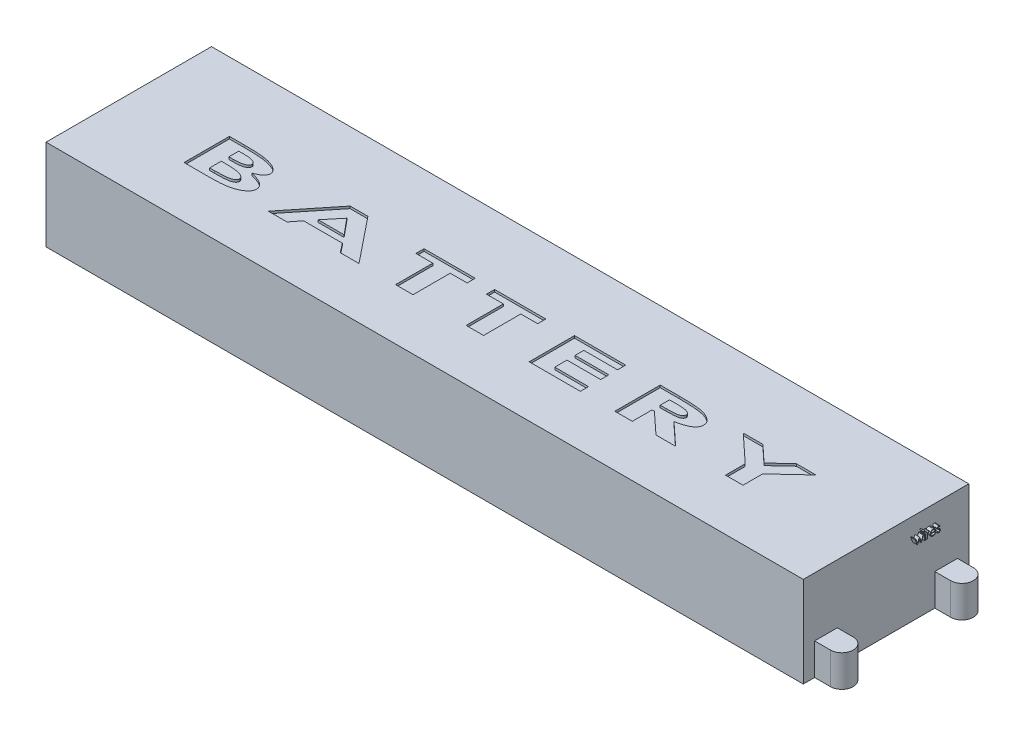
from build123d import *

# Parameters (mm, degrees)
SKETCH1_W           = 334
SKETCH1_H           = 73
BOSS_EXTRUDE1_DEPTH = 40
BOSS_EXTRUDE3_DEPTH = 14
SKETCH2_W           = 0.314102564
SKETCH2_H           = 2.557692308
BOSS_EXTRUDE2_DEPTH = 2
CUT_EXTRUDE1_DEPTH  = 1


with BuildPart() as part:
    # Sketch1 → Boss-Extrude1 (new body)
    with BuildSketch(Plane(origin=(0, 0, 0), x_dir=(1, 0, 0), z_dir=(0, 1, 0))):
        Rectangle(SKETCH1_W, SKETCH1_H)
    extrude(amount=BOSS_EXTRUDE1_DEPTH)

    # Sketch4 → Boss-Extrude3 (add)
    with BuildSketch(Plane(origin=(0, 0, 0), x_dir=(1, 0, 0), z_dir=(0, 1, 0))):
        with BuildLine():
            Line((167, -21.5), (174, -21.5))
            ThreePointArc((174, -21.5), (179, -26.5), (174, -31.5))
            Line((174, -31.5), (167, -31.5))
            Line((167, -31.5), (167, -21.5))
        make_face()
    boss_extrude3 = extrude(amount=BOSS_EXTRUDE3_DEPTH)

    # Mirror1: Boss-Extrude3 across plane
    add(boss_extrude3.mirror(Plane.XY))

    # Sketch2 → Boss-Extrude2 (add)
    # profile 1 of 6: a face of its own
    with BuildSketch(Plane(origin=(167, 0, 0), x_dir=(0, 0, -1), z_dir=(1, 0, 0))):
        Polygon((10.778846154, 32.557692308), (11.116085737, 32.557692308), (11.878205128, 30.717948718), (12.713241186, 32.557692308), (12.766526442, 32.557692308), (13.583333333, 30.717948718), (14.352463942, 32.557692308), (14.682692308, 32.557692308), (13.613481571, 30), (13.548277244, 30), (12.730769231, 31.83974359), (11.896434295, 30), (11.838241186, 30), align=None)
    # profile 2 of 6: a face of its own
    with BuildSketch(Plane(origin=(167, 0, 0), x_dir=(0, 0, -1), z_dir=(1, 0, 0))):
        with BuildLine():
            add(Edge.make_bspline(
                [(15.197315705, 33.634615385), (15.216807021, 33.633711232), (15.254974761, 33.631940728), (15.310168028, 33.616779251), (15.360425041, 33.591079566), (15.405002773, 33.556599885), (15.44325466, 33.516050441), (15.47003537, 33.468789473), (15.487247767, 33.417730834), (15.489326322, 33.382115745), (15.490384615, 33.363982372)],
                knots=[0, 0, 0, 0, 1.055194115, 2.066272739, 3.074728998, 4.095836921, 5.109056067, 6.073838105, 7.019297344, 8, 8, 8, 8], degree=3))
            add(Edge.make_bspline(
                [(15.490384615, 33.363982372), (15.489302456, 33.346319719), (15.487163154, 33.311402744), (15.470048665, 33.261229272), (15.443026428, 33.214624988), (15.405027302, 33.174154278), (15.360418541, 33.139693658), (15.310169755, 33.113988919), (15.254974307, 33.098828782), (15.216806867, 33.097058093), (15.197315705, 33.096153846)],
                knots=[0, 0, 0, 0, 0.96129708, 1.900370562, 2.859976407, 3.87933698, 4.906634145, 5.921202961, 6.938410037, 8, 8, 8, 8], degree=3))
            add(Edge.make_bspline(
                [(15.197315705, 33.096153846), (15.17804743, 33.097023566), (15.14054425, 33.098716363), (15.086177407, 33.114286381), (15.036348918, 33.139702454), (14.991684245, 33.173928639), (14.954454052, 33.214873536), (14.927355727, 33.26120083), (14.910280765, 33.311409985), (14.908136136, 33.346322151), (14.907051282, 33.363982372)],
                knots=[0, 0, 0, 0, 1.054934014, 2.053291228, 3.073705704, 4.106921865, 5.123545215, 6.088680038, 7.033164197, 8, 8, 8, 8], degree=3))
            add(Edge.make_bspline(
                [(14.907051282, 33.363982372), (14.908112369, 33.382113221), (14.91019641, 33.417723354), (14.927368526, 33.468818387), (14.954228334, 33.515799889), (14.991708897, 33.556825388), (15.036342357, 33.591070823), (15.086179103, 33.616481804), (15.140543802, 33.632053144), (15.178047278, 33.633745758), (15.197315705, 33.634615385)],
                knots=[0, 0, 0, 0, 0.98631895, 1.937192651, 2.907499808, 3.917963147, 4.944918757, 5.95915025, 6.951458133, 8, 8, 8, 8], degree=3))
        make_face()
    # profile 3 of 6: a face of its own
    with BuildSketch(Plane(origin=(167, 0, 0), x_dir=(0, 0, -1), z_dir=(1, 0, 0))):
        with Locations((15.198717949, 31.278846154)):
            Rectangle(SKETCH2_W, SKETCH2_H)
    # profile 4 of 6: a face of its own
    with BuildSketch(Plane(origin=(167, 0, 0), x_dir=(0, 0, -1), z_dir=(1, 0, 0))):
        with BuildLine():
            Line((16.028846154, 32.557692308), (16.342948718, 32.557692308))
            Line((16.342948718, 32.557692308), (16.342948718, 32.181189904))
            add(Edge.make_bspline(
                [(16.342948718, 32.181189904), (16.366137477, 32.216245732), (16.410485798, 32.283289731), (16.484198727, 32.371959032), (16.559702058, 32.445374079), (16.637357246, 32.503877598), (16.717735345, 32.547690717), (16.799072297, 32.579783752), (16.882647767, 32.598761067), (16.938809691, 32.601294726), (16.966947115, 32.602564103)],
                knots=[0, 0, 0, 0, 1.2804753, 2.448899062, 3.506932113, 4.484331642, 5.4025378, 6.288909075, 7.142734305, 8, 8, 8, 8], degree=3))
            add(Edge.make_bspline(
                [(16.966947115, 32.602564103), (16.988773442, 32.601373576), (17.033682527, 32.59892399), (17.101665117, 32.581713165), (17.171708569, 32.554235143), (17.216850956, 32.52839492), (17.240384615, 32.514923878)],
                knots=[0, 0, 0, 0, 0.901110191, 1.854092781, 2.881294221, 4, 4, 4, 4], degree=3))
            Line((17.240384615, 32.514923878), (17.067908654, 32.242888622))
            add(Edge.make_bspline(
                [(17.067908654, 32.242888622), (17.052799633, 32.249628888), (17.024119818, 32.262423203), (16.982165252, 32.277565213), (16.943483915, 32.286481129), (16.918840357, 32.287831847), (16.907351763, 32.288461538)],
                knots=[0, 0, 0, 0, 1.180555205, 2.24091978, 3.179933427, 4, 4, 4, 4], degree=3))
            add(Edge.make_bspline(
                [(16.907351763, 32.288461538), (16.882146029, 32.286781501), (16.830733639, 32.283354712), (16.75524914, 32.256415904), (16.682001934, 32.212890664), (16.623830272, 32.164619552), (16.578788019, 32.118071755), (16.546647794, 32.077423352), (16.517165047, 32.031844721), (16.488994826, 31.982115037), (16.463328532, 31.927385191), (16.439373863, 31.868201977), (16.417715, 31.804496849), (16.405364756, 31.760114328), (16.399038462, 31.737379808)],
                knots=[0, 0, 0, 0, 1.125678352, 2.296057538, 3.5422874, 4.923748041, 5.663163013, 6.437101912, 7.23742474, 8.08941207, 8.991984279, 9.93940061, 10.944477711, 12, 12, 12, 12], degree=3))
            add(Edge.make_bspline(
                [(16.399038462, 31.737379808), (16.394306068, 31.717102634), (16.383824176, 31.672190235), (16.373632639, 31.596841711), (16.363563121, 31.507818052), (16.356466502, 31.404871459), (16.34988846, 31.288259015), (16.346178378, 31.15780307), (16.343075237, 31.013369718), (16.342992171, 30.912395365), (16.342948718, 30.859575321)],
                knots=[0, 0, 0, 0, 0.566838948, 1.255505196, 2.06880316, 3.007127437, 4.065329342, 5.249902469, 6.561414163, 8, 8, 8, 8], degree=3))
            Line((16.342948718, 30.859575321), (16.342948718, 30))
            Line((16.342948718, 30), (16.028846154, 30))
            Line((16.028846154, 30), (16.028846154, 32.557692308))
        make_face()
    # profile 5 of 6: a face of its own
    with BuildSketch(Plane(origin=(167, 0, 0), x_dir=(0, 0, -1), z_dir=(1, 0, 0))):
        with BuildLine():
            Line((19.653645833, 30.807692308), (19.932692308, 30.661157853))
            add(Edge.make_bspline(
                [(19.932692308, 30.661157853), (19.910455712, 30.621714521), (19.867192104, 30.544973418), (19.792791356, 30.439541558), (19.714799283, 30.344693842), (19.629695315, 30.262964188), (19.540025637, 30.191712803), (19.445292982, 30.129374978), (19.345004164, 30.076256458), (19.239154439, 30.03150393), (19.126854888, 29.997094436), (19.007833372, 29.972790215), (18.881861876, 29.957766946), (18.795515696, 29.956021806), (18.751302083, 29.955128205)],
                knots=[0, 0, 0, 0, 1.120438281, 2.179929193, 3.190490725, 4.156257408, 5.095198341, 6.022838206, 6.959905092, 7.901321166, 8.864066838, 9.862729781, 10.905609505, 12, 12, 12, 12], degree=3))
            add(Edge.make_bspline(
                [(18.751302083, 29.955128205), (18.702160106, 29.95627538), (18.606298344, 29.958513187), (18.466758597, 29.977805652), (18.335379179, 30.00927801), (18.212167475, 30.053243552), (18.097425223, 30.110670876), (17.990924368, 30.180630358), (17.892104842, 30.262762612), (17.804080633, 30.357779056), (17.72483675, 30.459461013), (17.65491093, 30.565416898), (17.596453499, 30.675380122), (17.548900889, 30.788650646), (17.510496024, 30.90451454), (17.48372932, 31.024026007), (17.468299572, 31.146861592), (17.465935127, 31.229958927), (17.46474359, 31.271834936)],
                knots=[0, 0, 0, 0, 1.145258523, 2.234067595, 3.276747158, 4.290159414, 5.277019952, 6.260822364, 7.254936242, 8.264827045, 9.274100331, 10.257902744, 11.220704747, 12.172965371, 13.118907548, 14.062713208, 15.023725156, 16, 16, 16, 16], degree=3))
            add(Edge.make_bspline(
                [(17.46474359, 31.271834936), (17.465802731, 31.311129766), (17.467901809, 31.389006931), (17.481132597, 31.504272476), (17.50458089, 31.616300928), (17.536757214, 31.725185376), (17.57830846, 31.83074351), (17.629140679, 31.933039574), (17.689333057, 32.031964713), (17.735805731, 32.094367847), (17.759214744, 32.125801282)],
                knots=[0, 0, 0, 0, 1.024358464, 2.0301432, 3.019427413, 4.004406732, 4.986367066, 5.972626655, 6.978780325, 8, 8, 8, 8], degree=3))
            add(Edge.make_bspline(
                [(17.759214744, 32.125801282), (17.790922426, 32.163670152), (17.853333373, 32.238208303), (17.958889728, 32.336146628), (18.073189925, 32.418190404), (18.194801551, 32.48619754), (18.325138025, 32.537871187), (18.462447316, 32.576378769), (18.608292902, 32.59795678), (18.707998123, 32.601004614), (18.759014423, 32.602564103)],
                knots=[0, 0, 0, 0, 1.030682036, 2.02871468, 2.997146059, 3.962720338, 4.930598197, 5.918074684, 6.934738563, 8, 8, 8, 8], degree=3))
            add(Edge.make_bspline(
                [(18.759014423, 32.602564103), (18.811462028, 32.601210054), (18.914352274, 32.598553718), (19.064384395, 32.573927385), (19.206345112, 32.53487483), (19.340177616, 32.47972104), (19.465895477, 32.408561488), (19.582681527, 32.320419647), (19.692533039, 32.218001559), (19.756441618, 32.13923835), (19.78896234, 32.099158654)],
                knots=[0, 0, 0, 0, 1.056321875, 2.072262726, 3.055038591, 4.01806755, 4.982017516, 5.957941055, 6.960871419, 8, 8, 8, 8], degree=3))
            add(Edge.make_bspline(
                [(19.78896234, 32.099158654), (19.811089278, 32.068955072), (19.855195871, 32.008748954), (19.910442971, 31.910577797), (19.958400366, 31.807867202), (19.996733327, 31.698956905), (20.027772828, 31.585137325), (20.050229647, 31.46559478), (20.063399266, 31.340364869), (20.065987963, 31.255038314), (20.067307692, 31.211538462)],
                knots=[0, 0, 0, 0, 0.94817472, 1.890038105, 2.849395472, 3.817997239, 4.812318967, 5.836947057, 6.897266129, 8, 8, 8, 8], degree=3))
            Line((20.067307692, 31.211538462), (17.778846154, 31.211538462))
            add(Edge.make_bspline(
                [(17.778846154, 31.211538462), (17.78038576, 31.177837997), (17.783413334, 31.111567394), (17.797528477, 31.01459661), (17.819777251, 30.922223268), (17.851046314, 30.835140226), (17.888913159, 30.752210099), (17.935298876, 30.674048062), (17.99063843, 30.601010132), (18.052364129, 30.532442994), (18.121071225, 30.471382233), (18.193353972, 30.416730457), (18.270247537, 30.37092486), (18.35114562, 30.33374497), (18.435917405, 30.304638654), (18.5245896, 30.284770834), (18.616987717, 30.271463727), (18.679973451, 30.269984061), (18.712039263, 30.269230769)],
                knots=[0, 0, 0, 0, 1.094153842, 2.151609401, 3.174256925, 4.172055639, 5.149267565, 6.128595816, 7.11444997, 8.118368179, 9.117203808, 10.09244225, 11.054858984, 12.015122123, 12.976791628, 13.957293641, 14.960065497, 16, 16, 16, 16], degree=3))
            add(Edge.make_bspline(
                [(18.712039263, 30.269230769), (18.74339041, 30.269838826), (18.805597101, 30.271045327), (18.898237959, 30.282777238), (18.989377486, 30.301747513), (19.078638469, 30.327637504), (19.164209315, 30.359214356), (19.243454865, 30.397317213), (19.316335081, 30.43946696), (19.384452048, 30.487676635), (19.450523041, 30.546684822), (19.516065527, 30.620320543), (19.586342181, 30.707408071), (19.630331773, 30.772953737), (19.653645833, 30.807692308)],
                knots=[0, 0, 0, 0, 0.99110716, 1.966546729, 2.947904876, 3.932708344, 4.903319531, 5.828989031, 6.710028674, 7.56322171, 8.463672341, 9.504779593, 10.677557249, 12, 12, 12, 12], degree=3))
        make_face()
        with BuildLine():
            add(Edge.make_bspline(
                [(19.753205128, 31.525641026), (19.741708504, 31.567303899), (19.719581202, 31.64749152), (19.673344838, 31.75853241), (19.621273297, 31.857220311), (19.559651566, 31.942799944), (19.48983284, 32.018803457), (19.409187657, 32.085222043), (19.318751764, 32.144639494), (19.218992623, 32.194791993), (19.113350838, 32.237481852), (19.002744646, 32.266106968), (18.889886858, 32.28571651), (18.813552572, 32.287542618), (18.775140224, 32.288461538)],
                knots=[0, 0, 0, 0, 1.154881502, 2.222775134, 3.210006277, 4.132804581, 5.035138423, 5.962687519, 6.919655026, 7.923214229, 8.944639381, 9.960483929, 10.97369054, 12, 12, 12, 12], degree=3))
            add(Edge.make_bspline(
                [(18.775140224, 32.288461538), (18.743790786, 32.287849867), (18.681819537, 32.286640721), (18.590518469, 32.275170592), (18.50283877, 32.256210747), (18.418133482, 32.23024579), (18.337512614, 32.195637188), (18.259317845, 32.155053961), (18.185537449, 32.105512377), (18.139396154, 32.067753522), (18.116085737, 32.048677885)],
                knots=[0, 0, 0, 0, 1.04873581, 2.073130211, 3.073294108, 4.04793562, 5.032784715, 6.005352987, 6.992311501, 8, 8, 8, 8], degree=3))
            add(Edge.make_bspline(
                [(18.116085737, 32.048677885), (18.099392455, 32.033583569), (18.065609321, 32.003036353), (18.020468799, 31.950407146), (17.977248327, 31.893655584), (17.937914674, 31.83061046), (17.901837088, 31.761989681), (17.86807711, 31.688372045), (17.837690698, 31.609198915), (17.820594588, 31.554026476), (17.811798878, 31.525641026)],
                knots=[0, 0, 0, 0, 0.879870761, 1.780643979, 2.707998968, 3.669668524, 4.684282772, 5.740141944, 6.837334558, 8, 8, 8, 8], degree=3))
            Line((17.811798878, 31.525641026), (19.753205128, 31.525641026))
        make_face(mode=Mode.SUBTRACT)
    # profile 6 of 6: a face of its own
    with BuildSketch(Plane(origin=(167, 0, 0), x_dir=(0, 0, -1), z_dir=(1, 0, 0))):
        with BuildLine():
            Line((21.907051282, 32.238681891), (21.693910256, 32.019230769))
            add(Edge.make_bspline(
                [(21.693910256, 32.019230769), (21.675519753, 32.040543916), (21.640065027, 32.081633153), (21.583833546, 32.136570219), (21.527809943, 32.182707158), (21.472761129, 32.221659417), (21.41730286, 32.251108564), (21.362085942, 32.272603426), (21.307053203, 32.285905231), (21.270267168, 32.28761967), (21.252203526, 32.288461538)],
                knots=[0, 0, 0, 0, 1.26578478, 2.440284043, 3.530471711, 4.527705817, 5.468200915, 6.346673037, 7.188140097, 8, 8, 8, 8], degree=3))
            add(Edge.make_bspline(
                [(21.252203526, 32.288461538), (21.230064136, 32.287386665), (21.18649695, 32.285271468), (21.124071132, 32.264158037), (21.066120507, 32.231749299), (21.015963527, 32.185780715), (20.973475846, 32.133016446), (20.942462165, 32.074020122), (20.923496182, 32.010572078), (20.92109145, 31.96654222), (20.919871795, 31.944210737)],
                knots=[0, 0, 0, 0, 0.99966794, 1.967205029, 2.953328237, 3.988086729, 5.028030931, 6.008226631, 6.989793394, 8, 8, 8, 8], degree=3))
            add(Edge.make_bspline(
                [(20.919871795, 31.944210737), (20.920982607, 31.923998693), (20.9232011, 31.883631582), (20.94044778, 31.824083548), (20.967913852, 31.76602651), (20.993584046, 31.730463604), (21.006810897, 31.712139423)],
                knots=[0, 0, 0, 0, 0.960159726, 1.917612774, 2.927026955, 4, 4, 4, 4], degree=3))
            add(Edge.make_bspline(
                [(21.006810897, 31.712139423), (21.014774391, 31.702354839), (21.031723684, 31.681529584), (21.063532199, 31.652625731), (21.099554702, 31.62068348), (21.14287464, 31.588746643), (21.191625667, 31.555114918), (21.246864952, 31.521112785), (21.306839457, 31.48414836), (21.349776763, 31.460703924), (21.372095353, 31.448517628)],
                knots=[0, 0, 0, 0, 0.66740084, 1.420478572, 2.27185888, 3.217733974, 4.268547843, 5.408967954, 6.65319498, 8, 8, 8, 8], degree=3))
            add(Edge.make_bspline(
                [(21.372095353, 31.448517628), (21.39930893, 31.433272725), (21.4518766, 31.403824593), (21.526569367, 31.358114889), (21.594356408, 31.312683465), (21.655812076, 31.268016191), (21.709753884, 31.222863324), (21.757818437, 31.178955567), (21.798806881, 31.134966258), (21.821760808, 31.104233145), (21.832732372, 31.089543269)],
                knots=[0, 0, 0, 0, 1.27191281, 2.456916733, 3.569705269, 4.599008579, 5.553216877, 6.436649441, 7.252746552, 8, 8, 8, 8], degree=3))
            add(Edge.make_bspline(
                [(21.832732372, 31.089543269), (21.850942899, 31.059877181), (21.887185229, 31.00083616), (21.925243495, 30.903617733), (21.94730377, 30.80050723), (21.95036599, 30.72997501), (21.951923077, 30.694110577)],
                knots=[0, 0, 0, 0, 0.995354457, 1.980940102, 2.973342416, 4, 4, 4, 4], degree=3))
            add(Edge.make_bspline(
                [(21.951923077, 30.694110577), (21.951203543, 30.668841431), (21.949785623, 30.619045818), (21.939927556, 30.545710988), (21.92297258, 30.47557643), (21.899878826, 30.407881146), (21.868694453, 30.343922206), (21.832146656, 30.282085957), (21.788271744, 30.223710026), (21.738180368, 30.168871066), (21.683334875, 30.118785319), (21.624828736, 30.074761365), (21.562589906, 30.038187028), (21.497063104, 30.007921682), (21.42809945, 29.983853424), (21.355688161, 29.967190893), (21.280059406, 29.957218132), (21.228629598, 29.955833656), (21.202423878, 29.955128205)],
                knots=[0, 0, 0, 0, 1.032770009, 2.035186124, 3.017557409, 3.978232242, 4.952395191, 5.920591857, 6.910227898, 7.931268572, 8.952309245, 9.941945286, 10.918353717, 11.897095711, 12.887975737, 13.898235213, 14.929059601, 16, 16, 16, 16], degree=3))
            add(Edge.make_bspline(
                [(21.202423878, 29.955128205), (21.167056703, 29.956120905), (21.096813776, 29.958092513), (20.992924057, 29.976598574), (20.891403298, 30.005393968), (20.793019758, 30.045109902), (20.699973644, 30.095260615), (20.614842719, 30.155323008), (20.537331257, 30.223313006), (20.493212983, 30.275425916), (20.471153846, 30.301482372)],
                knots=[0, 0, 0, 0, 1.013940152, 2.01379169, 3.017749504, 4.037548394, 5.051665909, 6.043208538, 7.021604269, 8, 8, 8, 8], degree=3))
            Line((20.471153846, 30.301482372), (20.679387019, 30.538461538))
            add(Edge.make_bspline(
                [(20.679387019, 30.538461538), (20.699159432, 30.517106774), (20.737491244, 30.475707334), (20.798792461, 30.420582993), (20.861171862, 30.374381722), (20.924006549, 30.335738307), (20.988226643, 30.305962904), (21.053472257, 30.28504431), (21.119610682, 30.271600118), (21.164032817, 30.270021836), (21.186298077, 30.269230769)],
                knots=[0, 0, 0, 0, 1.179806542, 2.287233372, 3.337373186, 4.324005949, 5.273901747, 6.200048787, 7.097828587, 8, 8, 8, 8], degree=3))
            add(Edge.make_bspline(
                [(21.186298077, 30.269230769), (21.216616003, 30.270601594), (21.275852144, 30.273279956), (21.360695903, 30.297597048), (21.43903453, 30.335727), (21.507057875, 30.389811698), (21.564960036, 30.452767271), (21.606888211, 30.52368139), (21.633164386, 30.600472847), (21.636250385, 30.653705149), (21.637820513, 30.680789263)],
                knots=[0, 0, 0, 0, 1.072336372, 2.095165389, 3.102688358, 4.141489647, 5.156069229, 6.117746104, 7.042326257, 8, 8, 8, 8], degree=3))
            add(Edge.make_bspline(
                [(21.637820513, 30.680789263), (21.636734218, 30.703098881), (21.634589476, 30.747146237), (21.617746204, 30.810896578), (21.591133351, 30.871365859), (21.564928703, 30.906755506), (21.551582532, 30.924779647)],
                knots=[0, 0, 0, 0, 1.013901739, 2.00181326, 2.98231254, 4, 4, 4, 4], degree=3))
            add(Edge.make_bspline(
                [(21.551582532, 30.924779647), (21.543560138, 30.93381501), (21.526084465, 30.953497292), (21.494029224, 30.98192237), (21.455647362, 31.01256047), (21.410507199, 31.044892059), (21.358517737, 31.078490664), (21.299468261, 31.113180016), (21.234167709, 31.150607742), (21.187997078, 31.175427397), (21.163862179, 31.188401442)],
                knots=[0, 0, 0, 0, 0.615000592, 1.339693406, 2.178160186, 3.116406724, 4.166410947, 5.330106347, 6.604359322, 8, 8, 8, 8], degree=3))
            add(Edge.make_bspline(
                [(21.163862179, 31.188401442), (21.137815539, 31.202940574), (21.087302792, 31.23113659), (21.015755501, 31.275052671), (20.951208147, 31.319719945), (20.892107572, 31.362632784), (20.839946567, 31.406053728), (20.794930618, 31.45003098), (20.755287402, 31.492790966), (20.733339991, 31.523088263), (20.722856571, 31.537560096)],
                knots=[0, 0, 0, 0, 1.262093308, 2.447601706, 3.550203992, 4.582594899, 5.537233252, 6.418365656, 7.244515135, 8, 8, 8, 8], degree=3))
            add(Edge.make_bspline(
                [(20.722856571, 31.537560096), (20.704725971, 31.566705711), (20.668458436, 31.625007126), (20.633243244, 31.722317603), (20.609037216, 31.824762661), (20.606874825, 31.895449515), (20.605769231, 31.931590545)],
                knots=[0, 0, 0, 0, 0.985009483, 1.970363186, 2.962279964, 4, 4, 4, 4], degree=3))
            add(Edge.make_bspline(
                [(20.605769231, 31.931590545), (20.606303426, 31.955215943), (20.607348922, 32.001454194), (20.615692974, 32.069393014), (20.630884685, 32.133941168), (20.649939607, 32.196068031), (20.676422612, 32.254570125), (20.708068517, 32.310227596), (20.745255942, 32.362963514), (20.788099233, 32.411966646), (20.835205878, 32.456475972), (20.886100648, 32.4952746), (20.939638904, 32.528380955), (20.996047324, 32.556146116), (21.055867797, 32.577147498), (21.118682183, 32.591604883), (21.184363338, 32.601260086), (21.229264464, 32.602123171), (21.252203526, 32.602564103)],
                knots=[0, 0, 0, 0, 1.087655834, 2.128696564, 3.144119009, 4.137814668, 5.115653402, 6.093965665, 7.082169637, 8.081268856, 9.086088321, 10.061021666, 11.022561449, 11.980240094, 12.950172527, 13.934149372, 14.944599409, 16, 16, 16, 16], degree=3))
            add(Edge.make_bspline(
                [(21.252203526, 32.602564103), (21.279395589, 32.601459762), (21.334289811, 32.599230364), (21.416644437, 32.581524674), (21.498877779, 32.552391569), (21.581201129, 32.512155336), (21.663011418, 32.46008846), (21.745028275, 32.397159161), (21.828236305, 32.323781446), (21.880192618, 32.267682221), (21.907051282, 32.238681891)],
                knots=[0, 0, 0, 0, 0.845714091, 1.707292901, 2.609013841, 3.555613372, 4.552488639, 5.621697636, 6.770543573, 8, 8, 8, 8], degree=3))
        make_face()
    extrude(amount=BOSS_EXTRUDE2_DEPTH)

    # Sketch3 → Cut-Extrude1 (cut)
    # profile 1 of 7: a face of its own
    with BuildSketch(Plane(origin=(0, 40, 0), x_dir=(1, 0, 0), z_dir=(0, 1, 0))):
        with BuildLine():
            Line((-128.769230769, -13.833333333), (-128.769230769, 6.166666667))
            Line((-128.769230769, 6.166666667), (-122.138621795, 6.166666667))
            add(Edge.make_bspline(
                [(-122.138621795, 6.166666667), (-121.673868202, 6.166710349), (-120.776363255, 6.166794706), (-119.479598107, 6.144619916), (-118.279002801, 6.116498), (-117.175550768, 6.084284762), (-116.168704241, 6.029835025), (-115.260241877, 5.972029716), (-114.447742763, 5.902035062), (-113.940021711, 5.83951429), (-113.701121795, 5.810096154)],
                knots=[0, 0, 0, 0, 1.31998214, 2.549072282, 3.683500943, 4.730935446, 5.684263683, 6.547160721, 7.316390013, 8, 8, 8, 8], degree=3))
            add(Edge.make_bspline(
                [(-113.701121795, 5.810096154), (-113.393565068, 5.768604856), (-112.792635807, 5.687535796), (-111.919007274, 5.525502368), (-111.091768499, 5.341286884), (-110.312180795, 5.136710818), (-109.582330759, 4.898546569), (-108.901569636, 4.634955432), (-108.267047961, 4.34681245), (-107.683659307, 4.037052778), (-107.158508721, 3.706781648), (-106.700305314, 3.35921377), (-106.310074219, 2.998334926), (-105.993304393, 2.618601701), (-105.746143146, 2.223646464), (-105.565445056, 1.814467501), (-105.457345924, 1.387211145), (-105.443073171, 1.096485185), (-105.435897436, 0.950320513)],
                knots=[0, 0, 0, 0, 1.444239864, 2.821872898, 4.133831976, 5.388239239, 6.571533518, 7.705033956, 8.784268754, 9.813142222, 10.777069403, 11.668425098, 12.486344434, 13.245570479, 13.963067819, 14.647834093, 15.320188377, 16, 16, 16, 16], degree=3))
            add(Edge.make_bspline(
                [(-105.435897436, 0.950320513), (-105.438888653, 0.855287434), (-105.44482579, 0.666660394), (-105.495478226, 0.387122704), (-105.575121064, 0.114069146), (-105.688596966, -0.151862005), (-105.834556803, -0.411467431), (-106.015789574, -0.661775444), (-106.22627099, -0.908133677), (-106.467236552, -1.149593397), (-106.747187437, -1.384481073), (-107.069549574, -1.609137549), (-107.424806028, -1.840216872), (-107.826129255, -2.05864993), (-108.264132119, -2.280159294), (-108.746959339, -2.488480295), (-109.264609316, -2.704642144), (-109.62733528, -2.835947222), (-109.814903846, -2.903846154)],
                knots=[0, 0, 0, 0, 0.73412892, 1.457140681, 2.188870362, 2.928999352, 3.687054493, 4.486307402, 5.313796769, 6.189772561, 7.120317905, 8.134385744, 9.225455312, 10.39460865, 11.664228043, 13.018493101, 14.458238366, 16, 16, 16, 16], degree=3))
            add(Edge.make_bspline(
                [(-109.814903846, -2.903846154), (-109.513950512, -2.975427717), (-108.929925472, -3.114337709), (-108.08942069, -3.346768876), (-107.309326508, -3.58972295), (-106.592879759, -3.849445313), (-105.938647222, -4.121172777), (-105.346622579, -4.403641002), (-104.820156442, -4.705327239), (-104.352638749, -5.016753273), (-103.943893428, -5.343945545), (-103.58809847, -5.683490182), (-103.290877036, -6.042680859), (-103.041480465, -6.412238985), (-102.85328081, -6.800246965), (-102.713915871, -7.200290175), (-102.632174814, -7.617417754), (-102.621021739, -7.900826555), (-102.615384615, -8.044070513)],
                knots=[0, 0, 0, 0, 1.560057579, 3.027421822, 4.397137032, 5.679779435, 6.869333915, 7.968857049, 8.985549996, 9.927045053, 10.799049465, 11.623096799, 12.402674743, 13.146153443, 13.86607283, 14.571093087, 15.277784314, 16, 16, 16, 16], degree=3))
            add(Edge.make_bspline(
                [(-102.615384615, -8.044070513), (-102.620836364, -8.182023659), (-102.631735767, -8.457826363), (-102.718768396, -8.867155202), (-102.865350153, -9.264408589), (-103.064882598, -9.654999787), (-103.321357332, -10.034678038), (-103.640453062, -10.402276573), (-104.012576709, -10.760557292), (-104.437415999, -11.108733618), (-104.908108205, -11.435332663), (-105.409654817, -11.751558883), (-105.949337855, -12.038610299), (-106.520252449, -12.306223726), (-107.12502911, -12.5514009), (-107.761862984, -12.774422458), (-108.430968423, -12.979616505), (-109.139674916, -13.160378172), (-109.898179993, -13.323359412), (-110.721333903, -13.454695371), (-111.608897842, -13.578697989), (-112.567859605, -13.665367347), (-113.593364032, -13.744083004), (-114.68899222, -13.793159981), (-115.851024291, -13.826190747), (-116.648478635, -13.830907957), (-117.05849359, -13.833333333)],
                knots=[0, 0, 0, 0, 0.590042084, 1.17964111, 1.781712407, 2.397728595, 3.052407878, 3.737419508, 4.477092177, 5.260849838, 6.08539125, 6.92749391, 7.796908267, 8.699467972, 9.624953763, 10.588414995, 11.586399601, 12.619129434, 13.717672503, 14.90533072, 16.185677954, 17.552275451, 19.025136816, 20.58720367, 22.245294487, 24, 24, 24, 24], degree=3))
            Line((-117.05849359, -13.833333333), (-128.769230769, -13.833333333))
        make_face()
        with BuildLine():
            Line((-121.076923077, 2.576923077), (-121.076923077, -1.782051282))
            Line((-121.076923077, -1.782051282), (-119.225961538, -1.782051282))
            add(Edge.make_bspline(
                [(-119.225961538, -1.782051282), (-118.976199322, -1.780942398), (-118.493863352, -1.778800941), (-117.79505089, -1.750358409), (-117.145477027, -1.703692863), (-116.545574003, -1.635321111), (-115.994349272, -1.552891187), (-115.493555697, -1.450500604), (-115.042959971, -1.325838134), (-114.640738326, -1.186846233), (-114.286041758, -1.031615292), (-113.978281015, -0.858863956), (-113.718210262, -0.672686783), (-113.503270405, -0.473450969), (-113.336341959, -0.258559888), (-113.212839281, -0.029422611), (-113.142932035, 0.217150925), (-113.133138085, 0.385006709), (-113.128205128, 0.469551282)],
                knots=[0, 0, 0, 0, 1.704654372, 3.291995604, 4.772716245, 6.148760897, 7.412139669, 8.575936087, 9.635231733, 10.600978065, 11.478367912, 12.274325297, 13.005481925, 13.656761961, 14.267553572, 14.854693493, 15.423139034, 16, 16, 16, 16], degree=3))
            add(Edge.make_bspline(
                [(-113.128205128, 0.469551282), (-113.133471912, 0.548696227), (-113.143911037, 0.70556692), (-113.208220428, 0.935018858), (-113.326667562, 1.146890314), (-113.482966789, 1.348967378), (-113.689821733, 1.532979387), (-113.934483062, 1.711736704), (-114.229622919, 1.867543598), (-114.564216973, 2.018501666), (-114.945807273, 2.148056105), (-115.372643036, 2.264068887), (-115.846013466, 2.363973507), (-116.366443518, 2.442692251), (-116.933437357, 2.501383227), (-117.54542053, 2.544376303), (-118.204039905, 2.573891338), (-118.658352054, 2.575889273), (-118.893429487, 2.576923077)],
                knots=[0, 0, 0, 0, 0.573248763, 1.13621826, 1.707098723, 2.320047212, 2.976781728, 3.703807878, 4.508430471, 5.386834626, 6.358951356, 7.421225169, 8.587157953, 9.858551474, 11.229180048, 12.711929957, 14.298634394, 16, 16, 16, 16], degree=3))
            Line((-118.893429487, 2.576923077), (-121.076923077, 2.576923077))
        make_face(mode=Mode.SUBTRACT)
        with BuildLine():
            Line((-121.076923077, -5.115384615), (-121.076923077, -10.243589744))
            Line((-121.076923077, -10.243589744), (-119.009615385, -10.243589744))
            add(Edge.make_bspline(
                [(-119.009615385, -10.243589744), (-118.599610936, -10.242461888), (-117.814217086, -10.240301398), (-116.688135035, -10.21284272), (-115.666326276, -10.164660765), (-114.748287476, -10.1029358), (-113.935381769, -10.021467269), (-113.227161354, -9.916829647), (-112.622291047, -9.80224352), (-112.112995328, -9.660865499), (-111.687439479, -9.497598966), (-111.320570087, -9.326229381), (-111.009119164, -9.135141016), (-110.754766725, -8.92356481), (-110.555183826, -8.694228932), (-110.412595543, -8.447254806), (-110.323287595, -8.18090715), (-110.312917004, -7.996666475), (-110.307692308, -7.903846154)],
                knots=[0, 0, 0, 0, 2.042760453, 3.913058762, 5.611655864, 7.13909107, 8.497020976, 9.680799424, 10.705160778, 11.562468973, 12.310096949, 12.973778225, 13.577516776, 14.125315016, 14.616075177, 15.084022435, 15.538531152, 16, 16, 16, 16], degree=3))
            add(Edge.make_bspline(
                [(-110.307692308, -7.903846154), (-110.313257964, -7.797460726), (-110.324298497, -7.586425087), (-110.432562481, -7.282498116), (-110.600381513, -6.997757696), (-110.833216425, -6.731290324), (-111.132272772, -6.485445707), (-111.496053359, -6.259009609), (-111.924400259, -6.047006763), (-112.421082572, -5.850368626), (-112.994127167, -5.674355608), (-113.650414006, -5.524178608), (-114.391594598, -5.397833257), (-115.219388528, -5.296557533), (-116.133018976, -5.210641267), (-117.134167093, -5.159536811), (-118.221389258, -5.12108716), (-118.974852747, -5.117333953), (-119.366185897, -5.115384615)],
                knots=[0, 0, 0, 0, 0.501495216, 0.994810717, 1.507164792, 2.057939335, 2.658765087, 3.331591524, 4.080080005, 4.916289717, 5.85519198, 6.912262741, 8.098025072, 9.409389306, 10.855473132, 12.436881987, 14.149391157, 16, 16, 16, 16], degree=3))
            Line((-119.366185897, -5.115384615), (-121.076923077, -5.115384615))
        make_face(mode=Mode.SUBTRACT)
    # profile 2 of 7: a face of its own
    with BuildSketch(Plane(origin=(0, 40, 0), x_dir=(1, 0, 0), z_dir=(0, 1, 0))):
        Polygon((-75.541666667, 6.166666667), (-67.685096154, 6.166666667), (-51.615384615, -13.833333333), (-59.856570513, -13.833333333), (-63.073717949, -9.730769231), (-80.157051282, -9.730769231), (-83.378205128, -13.833333333), (-91.615384615, -13.833333333), align=None)
        Polygon((-71.615384615, 0.802083333), (-77.340544872, -6.141025641), (-65.890224359, -6.141025641), align=None, mode=Mode.SUBTRACT)
    # profile 3 of 7: a face of its own
    with BuildSketch(Plane(origin=(0, 40, 0), x_dir=(1, 0, 0), z_dir=(0, 1, 0))):
        Polygon((-42.923076923, 6.166666667), (-20.358974359, 6.166666667), (-20.358974359, 2.576923077), (-27.794871795, 2.576923077), (-27.794871795, -13.833333333), (-35.487179487, -13.833333333), (-35.487179487, 2.576923077), (-42.923076923, 2.576923077), align=None)
    # profile 4 of 7: a face of its own
    with BuildSketch(Plane(origin=(0, 40, 0), x_dir=(1, 0, 0), z_dir=(0, 1, 0))):
        Polygon((-11.794871795, 6.166666667), (10.769230769, 6.166666667), (10.769230769, 2.576923077), (3.333333333, 2.576923077), (3.333333333, -13.833333333), (-4.358974359, -13.833333333), (-4.358974359, 2.576923077), (-11.794871795, 2.576923077), align=None)
    # profile 5 of 7: a face of its own
    with BuildSketch(Plane(origin=(0, 40, 0), x_dir=(1, 0, 0), z_dir=(0, 1, 0))):
        Polygon((23.435897436, 6.166666667), (46, 6.166666667), (46, 2.576923077), (31.128205128, 2.576923077), (31.128205128, -1.269230769), (46, -1.269230769), (46, -4.858974359), (31.128205128, -4.858974359), (31.128205128, -10.243589744), (46, -10.243589744), (46, -13.833333333), (23.435897436, -13.833333333), align=None)
    # profile 6 of 7: a face of its own
    with BuildSketch(Plane(origin=(0, 40, 0), x_dir=(1, 0, 0), z_dir=(0, 1, 0))):
        with BuildLine():
            Line((61.230769231, 6.166666667), (69.684294872, 6.166666667))
            add(Edge.make_bspline(
                [(69.684294872, 6.166666667), (69.968748271, 6.165151665), (70.526971612, 6.162178562), (71.348337965, 6.160856006), (72.137590934, 6.147230508), (72.896163095, 6.131806162), (73.622654169, 6.111335373), (74.318608909, 6.089370963), (74.983415828, 6.05402526), (75.618127116, 6.025661352), (76.220293357, 5.983829439), (76.790593253, 5.940161765), (77.330193318, 5.892370982), (77.839084685, 5.840550789), (78.317238823, 5.784396642), (78.763419922, 5.724880003), (79.179304857, 5.661895769), (79.684524513, 5.565328769), (80.28217151, 5.436578237), (80.96579164, 5.25774218), (81.6129418, 5.053044546), (82.223190661, 4.825300807), (82.798012382, 4.571763342), (83.338765784, 4.297683115), (83.841591288, 3.99564958), (84.305856036, 3.673010357), (84.724716723, 3.33109554), (85.094964485, 2.973917172), (85.403489558, 2.59611962), (85.660014123, 2.205151892), (85.858586738, 1.797295342), (85.998762635, 1.374280863), (86.087275162, 0.935294391), (86.097419411, 0.636905759), (86.102564103, 0.485576923)],
                knots=[0, 0, 0, 0, 1.447747822, 2.841121361, 4.180258665, 5.46515348, 6.702649317, 7.87921363, 9.008802404, 10.090870714, 11.112663307, 12.080709401, 13.001903797, 13.869615965, 14.68402087, 15.452066414, 16.160539564, 16.824409067, 18.069589957, 19.271424528, 20.419309892, 21.522685964, 22.58478148, 23.615263057, 24.606067619, 25.567697667, 26.490195027, 27.35534788, 28.181243678, 28.967391338, 29.730397892, 30.482672798, 31.23048221, 32, 32, 32, 32], degree=3))
            add(Edge.make_bspline(
                [(86.102564103, 0.485576923), (86.096331466, 0.327516952), (86.084021857, 0.0153447), (85.988060911, -0.441560643), (85.836017127, -0.879474301), (85.615115574, -1.296430127), (85.333588245, -1.69237063), (84.991079207, -2.068967724), (84.589603656, -2.426834565), (84.119309637, -2.756524227), (83.594307159, -3.076067599), (83.001192376, -3.363918049), (82.351963254, -3.643445877), (81.635187481, -3.891887553), (80.859086631, -4.128578112), (80.019372183, -4.343832589), (79.11863889, -4.540267569), (78.494816576, -4.650182662), (78.173878205, -4.706730769)],
                knots=[0, 0, 0, 0, 0.738510582, 1.4585762, 2.173479213, 2.89966467, 3.656763107, 4.439287494, 5.275198475, 6.165849881, 7.121074261, 8.14592728, 9.245426128, 10.424461814, 11.690624821, 13.03852549, 14.476407813, 16, 16, 16, 16], degree=3))
            Line((78.173878205, -4.706730769), (88.025641026, -13.833333333))
            Line((88.025641026, -13.833333333), (79.363782051, -13.833333333))
            Line((79.363782051, -13.833333333), (69.952724359, -5.115384615))
            Line((69.952724359, -5.115384615), (68.923076923, -5.115384615))
            Line((68.923076923, -5.115384615), (68.923076923, -13.833333333))
            Line((68.923076923, -13.833333333), (61.230769231, -13.833333333))
            Line((61.230769231, -13.833333333), (61.230769231, 6.166666667))
        make_face()
        with BuildLine():
            Line((68.923076923, -1.525641026), (71.507211538, -1.525641026))
            add(Edge.make_bspline(
                [(71.507211538, -1.525641026), (71.822385002, -1.523695145), (72.427424303, -1.519959632), (73.297176219, -1.503065769), (74.090524223, -1.461518547), (74.806519227, -1.410154306), (75.447381331, -1.349769047), (76.009724065, -1.264856276), (76.497641251, -1.17216348), (76.912875368, -1.05933632), (77.267542059, -0.93103935), (77.571487079, -0.78412787), (77.827530996, -0.612831761), (78.043832543, -0.427644944), (78.207268731, -0.213429309), (78.325718337, 0.016743279), (78.396784537, 0.269121351), (78.405676283, 0.443718884), (78.41025641, 0.533653846)],
                knots=[0, 0, 0, 0, 1.941146161, 3.726423238, 5.35702916, 6.833163903, 8.147527669, 9.320030401, 10.334631107, 11.204606299, 11.967041687, 12.654891231, 13.277652523, 13.860286715, 14.399880292, 14.925888225, 15.446726421, 16, 16, 16, 16], degree=3))
            add(Edge.make_bspline(
                [(78.41025641, 0.533653846), (78.402391158, 0.640822064), (78.386453823, 0.857976682), (78.231547579, 1.1625598), (77.994082988, 1.442320529), (77.665465384, 1.687764319), (77.267567191, 1.910657161), (76.803554985, 2.102508155), (76.276666742, 2.255841884), (75.790002559, 2.355876426), (75.344706907, 2.416901769), (74.940042996, 2.461445034), (74.472173482, 2.494796994), (73.939424575, 2.528455055), (73.342287248, 2.550888377), (72.679837465, 2.567012234), (71.95460623, 2.573692696), (71.44978652, 2.575816337), (71.186698718, 2.576923077)],
                knots=[0, 0, 0, 0, 0.635787271, 1.288293716, 1.995563529, 2.813518098, 3.720151647, 4.71346607, 5.80296468, 6.991050822, 7.675307862, 8.485143574, 9.420510408, 10.47461831, 11.671230475, 12.986838517, 14.42968486, 16, 16, 16, 16], degree=3))
            Line((71.186698718, 2.576923077), (68.923076923, 2.576923077))
            Line((68.923076923, 2.576923077), (68.923076923, -1.525641026))
        make_face(mode=Mode.SUBTRACT)
    # profile 7 of 7: a face of its own
    with BuildSketch(Plane(origin=(0, 40, 0), x_dir=(1, 0, 0), z_dir=(0, 1, 0))):
        Polygon((97.871794872, 6.166666667), (106.529647436, 6.166666667), (113.901442308, -0.696314103), (121.269230769, 6.166666667), (129.923076923, 6.166666667), (117.743589744, -5.171474359), (117.743589744, -13.833333333), (110.051282051, -13.833333333), (110.051282051, -5.171474359), align=None)
    extrude(amount=-CUT_EXTRUDE1_DEPTH, mode=Mode.SUBTRACT)


solid = part.part
